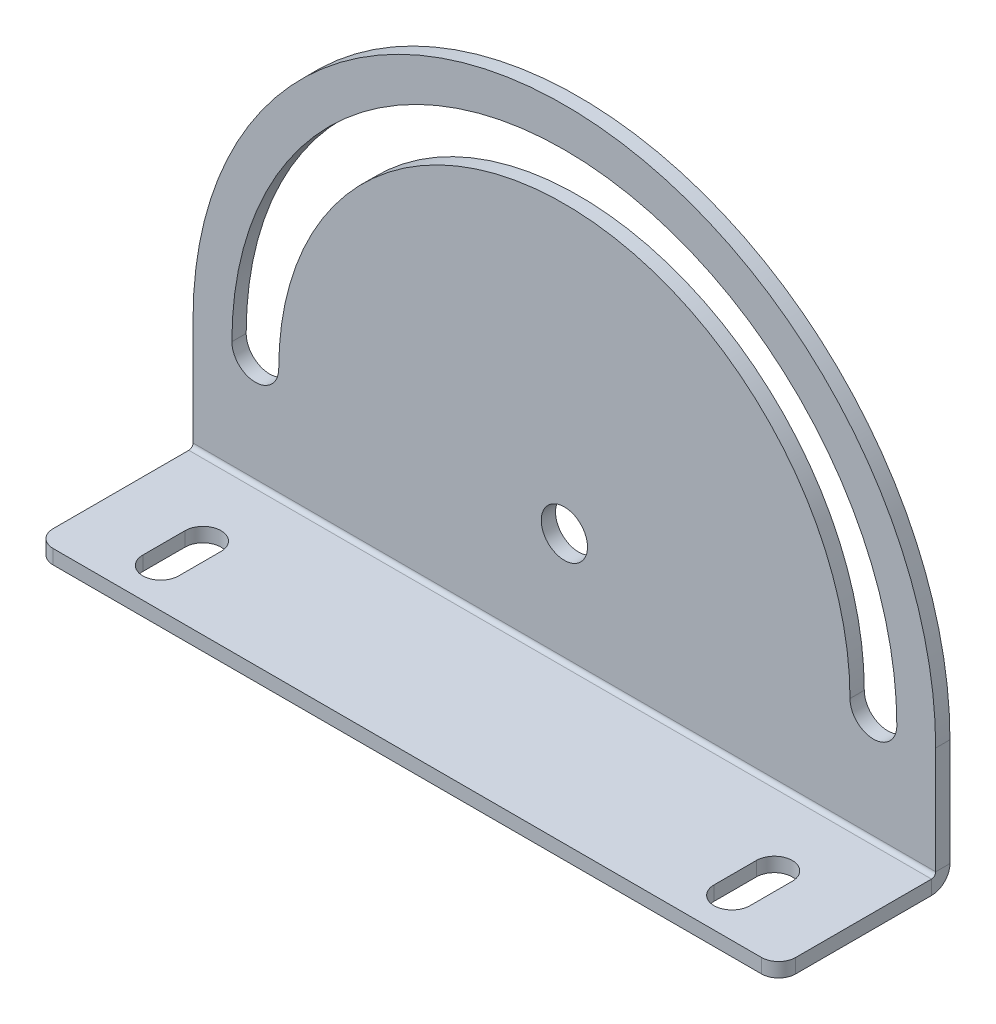
from build123d import *

# Parameters (mm, degrees)
ESQUISSE1_R                           = 4.05
T_LE_DE_BASE_PLI_E1_DEPTH             = 2.5
T_LE_PLI_E_SUR_AR_TE1_STRIP_W         = 11.4732
T_LE_PLI_E_SUR_AR_TE1_STRIP_H         = 2.5
T_LE_PLI_E_SUR_AR_TE1_STRIP_CUT_DEPTH = 130
T_LE_PLI_E_SUR_AR_TE1_DEPTH           = 130
CONG_1_R                              = 3
ENL_V_MAT_EXTRU_1_DEPTH               = 10


# Sheet-metal steps are written as plain solids
with BuildPart() as part:
    # Esquisse1 → Tôle de base pliée1 (new body)
    with BuildSketch(Plane.XY):
        with BuildLine():
            Line((0, 0), (130, 0))
            Line((130, 0), (130, 22))
            ThreePointArc((130, 22), (65, 87), (0, 22))
            Line((0, 22), (0, 0))
        make_face()
        with Locations((65, 22)):
            Circle(ESQUISSE1_R, mode=Mode.SUBTRACT)
        with BuildLine():
            ThreePointArc((123.2, 22), (65, 80.2), (6.8, 22))
            ThreePointArc((6.8, 22), (10.9, 17.9), (15, 22))
            ThreePointArc((15, 22), (65, 72), (115, 22))
            ThreePointArc((115, 22), (119.1, 17.9), (123.2, 22))
        make_face(mode=Mode.SUBTRACT)
    extrude(amount=-T_LE_DE_BASE_PLI_E1_DEPTH)

    # Tôle pliée sur arête1 strip (across the edge) → Tôle pliée sur arête1 strip cut (cut)
    with BuildSketch(Plane.YZ):
        with Locations((-2.5, -1.25)):
            Rectangle(T_LE_PLI_E_SUR_AR_TE1_STRIP_W, T_LE_PLI_E_SUR_AR_TE1_STRIP_H)
    extrude(amount=T_LE_PLI_E_SUR_AR_TE1_STRIP_CUT_DEPTH, mode=Mode.SUBTRACT)

    # Tôle pliée sur arête1 section (across the edge) → Tôle pliée sur arête1 (add)
    with BuildSketch(Plane.YZ):
        with BuildLine():
            Line((0, 0.7366), (0, 27.5))
            Line((0, 27.5), (2.5, 27.5))
            Line((2.5, 27.5), (2.5, 0.7366))
            ThreePointArc((2.5, 0.7366), (2.715745145, 0.215745145), (3.2366, 0))
            Line((3.2366, 0), (3.2366, -2.5))
            ThreePointArc((3.2366, -2.5), (0.947978192, -1.552021808), (0, 0.7366))
        make_face()
    extrude(amount=T_LE_PLI_E_SUR_AR_TE1_DEPTH)

    # Congé1
    cong_1_edges = [part.edges().sort_by_distance(p)[0] for p in [
        (0, 1.25, 27.5),
        (130, 1.25, 27.5),
    ]]
    fillet(cong_1_edges, radius=CONG_1_R)

    # Esquisse9 → Enlèv. mat.-Extru.1 (cut)
    with BuildSketch(Plane(origin=(0, 2.5, 0), x_dir=(1, 0, 0), z_dir=(0, 1, 0))):
        with BuildLine():
            Line((18.15, -13.25), (18.15, -20.65))
            ThreePointArc((18.15, -20.65), (15, -23.8), (11.85, -20.65))
            Line((11.85, -20.65), (11.85, -13.25))
            ThreePointArc((11.85, -13.25), (15, -10.1), (18.15, -13.25))
        make_face()
        with BuildLine():
            Line((111.85, -13.25), (111.85, -20.65))
            ThreePointArc((111.85, -20.65), (115, -23.8), (118.15, -20.65))
            Line((118.15, -20.65), (118.15, -13.25))
            ThreePointArc((118.15, -13.25), (115, -10.1), (111.85, -13.25))
        make_face()
    extrude(amount=-ENL_V_MAT_EXTRU_1_DEPTH, mode=Mode.SUBTRACT)


solid = part.part
